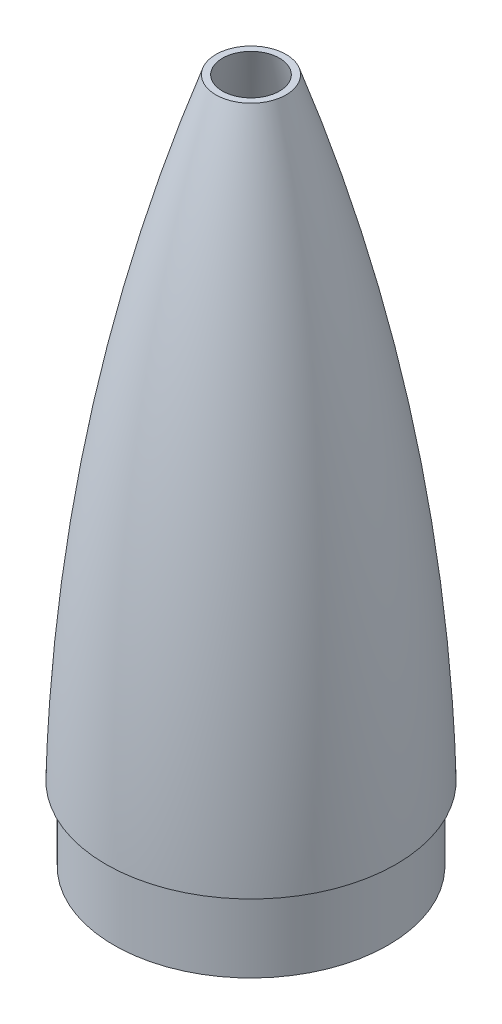
from build123d import *

# Parameters (mm, degrees)
SKETCH7_R           = 317.5
CUT_EXTRUDE2_DEPTH  = 50.8
SKETCH8_R           = 74.041
SKETCH8_R_2         = 70.739
BOSS_EXTRUDE1_DEPTH = 40


with BuildPart() as part:
    # Sketch2 → Revolve1 (revolve)
    with BuildSketch(Plane.XY):
        with BuildLine():
            Line((-78.359, 0), (-70.739, 0))
            ThreePointArc((-70.739, 0), (-50.36013831, 190.780873493), (0, 375.92))
            Line((0, 375.92), (0, 381))
            ThreePointArc((0, 381), (-56.258776919, 194.012637953), (-78.359, 0))
        make_face()
    revolve(axis=Axis((0, 381, 0), (0, -1, 0)))

    # Sketch7 → Cut-Extrude2 (cut)
    with BuildSketch(Plane(origin=(0, 381, 0), x_dir=(1, 0, 0), z_dir=(0, 1, 0))):
        Circle(SKETCH7_R)
    extrude(amount=-CUT_EXTRUDE2_DEPTH, mode=Mode.SUBTRACT)

    # Sketch8 → Boss-Extrude1 (add)
    with BuildSketch(Plane.XZ):
        Circle(SKETCH8_R)
        Circle(SKETCH8_R_2, mode=Mode.SUBTRACT)
    extrude(amount=BOSS_EXTRUDE1_DEPTH)


solid = part.part
